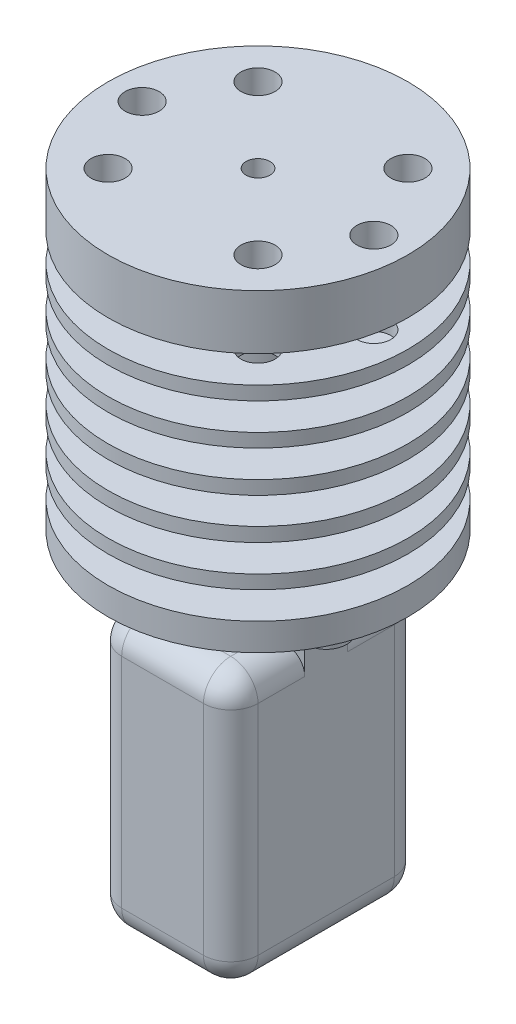
from build123d import *

# Parameters (mm, degrees)
SKETCH1_R                 = 11
BOSS_EXTRUDE2_DEPTH       = 4
SKETCH2_R                 = 5
BOSS_EXTRUDE3_DEPTH       = 2
SKETCH3_R                 = 11
BOSS_EXTRUDE4_DEPTH       = 1.002207304
SKETCH4_R                 = 5
BOSS_EXTRUDE5_DEPTH       = 2
SKETCH5_R                 = 11
BOSS_EXTRUDE6_DEPTH       = 1
SKETCH6_R                 = 5
BOSS_EXTRUDE7_DEPTH       = 2
SKETCH7_R                 = 11
BOSS_EXTRUDE8_DEPTH       = 1
SKETCH8_R                 = 5
BOSS_EXTRUDE9_DEPTH       = 2
BOSS_EXTRUDE10_DEPTH      = 1
BOSS_EXTRUDE10_DEPTH_BACK = 0.02884934
SKETCH9_R                 = 11
SKETCH10_R                = 5
BOSS_EXTRUDE11_DEPTH      = 2
SKETCH11_R                = 11
BOSS_EXTRUDE12_DEPTH      = 1
SKETCH12_R                = 5
BOSS_EXTRUDE13_DEPTH      = 2
SKETCH13_R                = 11
BOSS_EXTRUDE14_DEPTH      = 2
BOSS_EXTRUDE15_DEPTH      = 4
SKETCH15_W                = 10
SKETCH15_H                = 14
BOSS_EXTRUDE16_DEPTH      = 20
SKETCH17_R                = 2.5
BOSS_EXTRUDE17_DEPTH      = 3
BOSS_EXTRUDE17_TAPER      = 32
SKETCH18_R                = 0.875
CUT_EXTRUDE2_DEPTH        = 48
SKETCH19_R                = 0.2
CUT_EXTRUDE3_DEPTH        = 5
FILLET1_R                 = 2
FILLET2_R                 = 2
SKETCH20_R                = 1.25
CUT_EXTRUDE4_DEPTH        = 8
SKETCH22_R                = 1.25
CUT_EXTRUDE5_DEPTH        = 8


with BuildPart() as part:
    # Sketch1 → Boss-Extrude2 (new body)
    with BuildSketch(Plane(origin=(0, 0, 0), x_dir=(1, 0, 0), z_dir=(0, 1, 0))):
        with Locations(Location((0, 0, 0), (0, 0, 270))):
            Circle(SKETCH1_R)
    extrude(amount=-BOSS_EXTRUDE2_DEPTH)

    # Sketch2 → Boss-Extrude3 (add)
    with BuildSketch(Plane(origin=(0, -4, 0), x_dir=(-1, 0, 0), z_dir=(0, -1, 0))):
        with Locations(Location((0, 0, 0), (0, 0, 90))):
            Circle(SKETCH2_R)
    extrude(amount=BOSS_EXTRUDE3_DEPTH)

    # Sketch3 → Boss-Extrude4 (add)
    with BuildSketch(Plane.XZ.offset(6)):
        with Locations(Location((0, 0, 0), (0, 0, 90))):
            Circle(SKETCH3_R)
    extrude(amount=BOSS_EXTRUDE4_DEPTH)

    # Sketch4 → Boss-Extrude5 (add)
    with BuildSketch(Plane(origin=(0, -7.002207304, 0), x_dir=(-1, 0, 0), z_dir=(0, -1, 0))):
        with Locations(Location((0, 0, 0), (0, 0, 90))):
            Circle(SKETCH4_R)
    extrude(amount=BOSS_EXTRUDE5_DEPTH)

    # Sketch5 → Boss-Extrude6 (add)
    with BuildSketch(Plane.XZ.offset(9.002207304)):
        with Locations(Location((0, 0, 0), (0, 0, 90))):
            Circle(SKETCH5_R)
    extrude(amount=BOSS_EXTRUDE6_DEPTH)

    # Sketch6 → Boss-Extrude7 (add)
    with BuildSketch(Plane(origin=(0, -10.002207304, 0), x_dir=(-1, 0, 0), z_dir=(0, -1, 0))):
        with Locations(Location((0, 0, 0), (0, 0, 90))):
            Circle(SKETCH6_R)
    extrude(amount=BOSS_EXTRUDE7_DEPTH)

    # Sketch7 → Boss-Extrude8 (add)
    with BuildSketch(Plane(origin=(0, -12.002207304, 0), x_dir=(-1, 0, 0), z_dir=(0, -1, 0))):
        with Locations(Location((0, 0, 0), (0, 0, 270))):
            Circle(SKETCH7_R)
    extrude(amount=BOSS_EXTRUDE8_DEPTH)

    # Sketch8 → Boss-Extrude9 (add)
    with BuildSketch(Plane(origin=(0, -13.002207304, 0), x_dir=(-1, 0, 0), z_dir=(0, -1, 0))):
        with Locations(Location((0, 0, 0), (0, 0, 90))):
            Circle(SKETCH8_R)
    extrude(amount=BOSS_EXTRUDE9_DEPTH)

    # Sketch9 → Boss-Extrude10 (add, two sides: drawn at the far end of the back side and taken through both)
    with BuildSketch(Plane(origin=(0, -15.002207304, 0), x_dir=(-1, 0, 0), z_dir=(0, -1, 0)).offset(-BOSS_EXTRUDE10_DEPTH_BACK)):
        with Locations(Location((0, 0, 0), (0, 0, 270))):
            Circle(SKETCH9_R)
    extrude(amount=BOSS_EXTRUDE10_DEPTH + BOSS_EXTRUDE10_DEPTH_BACK)

    # Sketch10 → Boss-Extrude11 (add)
    with BuildSketch(Plane(origin=(0, -16.002207304, 0), x_dir=(-1, 0, 0), z_dir=(0, -1, 0))):
        with Locations(Location((0, 0, 0), (0, 0, 90))):
            Circle(SKETCH10_R)
    extrude(amount=BOSS_EXTRUDE11_DEPTH)

    # Sketch11 → Boss-Extrude12 (add)
    with BuildSketch(Plane(origin=(0, -18.002207304, 0), x_dir=(-1, 0, 0), z_dir=(0, -1, 0))):
        with Locations(Location((0, 0, 0), (0, 0, 270))):
            Circle(SKETCH11_R)
    extrude(amount=BOSS_EXTRUDE12_DEPTH)

    # Sketch12 → Boss-Extrude13 (add)
    with BuildSketch(Plane(origin=(0, -19.002207304, 0), x_dir=(-1, 0, 0), z_dir=(0, -1, 0))):
        with Locations(Location((0, 0, 0), (0, 0, 90))):
            Circle(SKETCH12_R)
    extrude(amount=BOSS_EXTRUDE13_DEPTH)

    # Sketch13 → Boss-Extrude14 (add)
    with BuildSketch(Plane(origin=(0, -21.002207304, 0), x_dir=(-1, 0, 0), z_dir=(0, -1, 0))):
        with Locations(Location((0, 0, 0), (0, 0, 270))):
            Circle(SKETCH13_R)
    extrude(amount=BOSS_EXTRUDE14_DEPTH)

    # Sketch14 → Boss-Extrude15 (add)
    with BuildSketch(Plane(origin=(0, -23.002207304, 0), x_dir=(-1, 0, 0), z_dir=(0, -1, 0))):
        with BuildLine():
            Line((5.450000001, -1.4309088), (0.900000001, -2.861817604))
            ThreePointArc((0.900000001, -2.861817604), (1e-09, -3), (-0.9, -2.861817604))
            Line((-0.9, -2.861817604), (-5.45, -1.430908802))
            ThreePointArc((-5.45, -1.430908802), (-6.5, 0), (-5.45, 1.430908802))
            Line((-5.45, 1.430908802), (-0.9, 2.861817604))
            ThreePointArc((-0.9, 2.861817604), (-1e-09, 3), (0.899999999, 2.861817605))
            Line((0.899999999, 2.861817605), (5.450000001, 1.430908804))
            ThreePointArc((5.450000001, 1.430908804), (6.5, 2e-09), (5.450000001, -1.4309088))
        make_face()
    extrude(amount=BOSS_EXTRUDE15_DEPTH)

    # Sketch15 → Boss-Extrude16 (add)
    with BuildSketch(Plane(origin=(0, -27.002207304, 0), x_dir=(-1, 0, 0), z_dir=(0, -1, 0))):
        Rectangle(SKETCH15_W, SKETCH15_H)
    extrude(amount=BOSS_EXTRUDE16_DEPTH)

    # Sketch17 → Boss-Extrude17 (add)
    with BuildSketch(Plane(origin=(0, -47.002207304, 0), x_dir=(-1, 0, 0), z_dir=(0, -1, 0))):
        Circle(SKETCH17_R)
    extrude(amount=BOSS_EXTRUDE17_DEPTH, taper=BOSS_EXTRUDE17_TAPER)

    # Sketch18 → Cut-Extrude2 (cut)
    with BuildSketch(Plane(origin=(0, 0, 0), x_dir=(1, 0, 0), z_dir=(0, 1, 0))):
        with Locations(Location((0, 0, 0), (0, 0, 270))):
            Circle(SKETCH18_R)
    extrude(amount=-CUT_EXTRUDE2_DEPTH, mode=Mode.SUBTRACT)

    # Sketch19 → Cut-Extrude3 (cut)
    with BuildSketch(Plane(origin=(0, -50.002207304, 0), x_dir=(-1, 0, 0), z_dir=(0, -1, 0))):
        with Locations(Location((0, 0, 0), (0, 0, 90))):
            Circle(SKETCH19_R)
    extrude(amount=-CUT_EXTRUDE3_DEPTH, mode=Mode.SUBTRACT)

    # Fillet1
    fillet1_edges = [part.edges().sort_by_distance(p)[0] for p in [
        (5, -27.002207304, -4.286213628),
        (5, -27.002207304, 4.286213628),
        (5, -37.002207304, -7),
        (0, -27.002207304, 7),
        (5, -37.002207304, 7),
        (-5, -27.002207304, 4.286213627),
        (-5, -27.002207304, -4.286213629),
        (0, -27.002207304, -7),
        (-5, -37.002207304, -7),
        (5, -47.002207304, 0),
        (0, -47.002207304, 7),
        (-5, -47.002207304, 0),
        (0, -47.002207304, -7),
    ]]
    fillet(fillet1_edges, radius=FILLET1_R)

    # Fillet2
    # the kernel refuses this fillet: 2 mm, written as the material it takes off along each edge
    with BuildSketch(Plane(origin=(-3, -29.002207304, 5), x_dir=(0, 0, 1), z_dir=(-1, 0, 0))) as fillet2_piece_1_section:
        Polygon((0, 0), (FILLET2_R, 0), (FILLET2_R, FILLET2_R), (0, FILLET2_R), align=None)
    fillet2_piece_1 = extrude(amount=FILLET2_R, mode=Mode.PRIVATE)
    fillet2_piece_1 = fillet2_piece_1 - Plane(origin=(-3, -29.002207304, 5), x_dir=(0, -0.7071067811865475, -0.7071067811865475), z_dir=(-1, 0, 0)) * Sphere(FILLET2_R, mode=Mode.PRIVATE)
    add(fillet2_piece_1, mode=Mode.SUBTRACT)
    with BuildSketch(Plane(origin=(-3, -45.002207304, 5), x_dir=(0, 0, 1), z_dir=(-1, 0, 0))) as fillet2_piece_2_section:
        Polygon((0, 0), (FILLET2_R, 0), (FILLET2_R, -FILLET2_R), (0, -FILLET2_R), align=None)
    fillet2_piece_2 = extrude(amount=FILLET2_R, mode=Mode.PRIVATE)
    fillet2_piece_2 = fillet2_piece_2 - Plane(origin=(-3, -45.002207304, 5), x_dir=(0, 0.7071067811865475, -0.7071067811865475), z_dir=(-1, 0, 0)) * Sphere(FILLET2_R, mode=Mode.PRIVATE)
    add(fillet2_piece_2, mode=Mode.SUBTRACT)
    with BuildSketch(Plane(origin=(-5, -29.002207304, 7), x_dir=(0, 0, -1), z_dir=(0, -1, 0))) as fillet2_piece_3:
        with BuildLine():
            CenterArc((FILLET2_R, FILLET2_R), FILLET2_R, 180, 90)
            Line((0, FILLET2_R), (0, 0))
            Line((0, 0), (FILLET2_R, 0))
        make_face()
    extrude(amount=16, mode=Mode.SUBTRACT)

    # Sketch20 → Cut-Extrude4 (cut)
    with BuildSketch(Plane(origin=(0, 0, 0), x_dir=(1, 0, 0), z_dir=(0, 1, 0))):
        with Locations(Location((-5.5, 5.5, 0), (0, 0, 90))):
            Circle(SKETCH20_R)
        with Locations(Location((5.5, 5.5, 0), (0, 0, 90))):
            Circle(SKETCH20_R)
        with Locations(Location((-5.5, -5.5, 0), (0, 0, 90))):
            Circle(SKETCH20_R)
        with Locations(Location((5.5, -5.5, 0), (0, 0, 90))):
            Circle(SKETCH20_R)
    extrude(amount=-CUT_EXTRUDE4_DEPTH, mode=Mode.SUBTRACT)

    # Sketch22 → Cut-Extrude5 (cut)
    with BuildSketch(Plane(origin=(0, 0, 0), x_dir=(1, 0, 0), z_dir=(0, 1, 0))):
        with Locations(Location((-8.5, 0, 0), (0, 0, 90))):
            Circle(SKETCH22_R)
        with Locations(Location((8.5, 0, 0), (0, 0, 90))):
            Circle(SKETCH22_R)
    extrude(amount=-CUT_EXTRUDE5_DEPTH, mode=Mode.SUBTRACT)


solid = part.part
